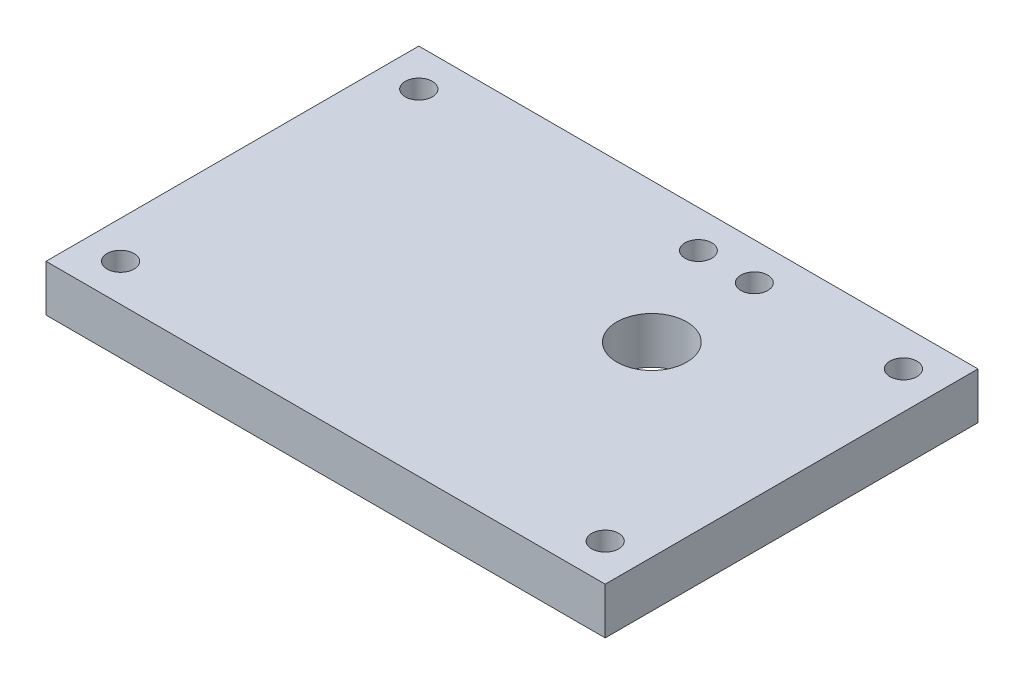
from build123d import *

# Parameters (mm, degrees)
SKETCH1_W           = 76.2
SKETCH1_H           = 50.8
BOSS_EXTRUDE1_DEPTH = 6.35
SKETCH2_R           = 1.8415
CUT_EXTRUDE1_DEPTH  = 47.228697797
SKETCH3_R           = 4.7625
SKETCH3_R_2         = 1.8288
CUT_EXTRUDE2_DEPTH  = 47.228697797


with BuildPart() as part:
    # Sketch1 → Boss-Extrude1 (new body)
    with BuildSketch(Plane(origin=(0, 0, 0), x_dir=(1, 0, 0), z_dir=(0, 1, 0))):
        Rectangle(SKETCH1_W, SKETCH1_H)
    extrude(amount=BOSS_EXTRUDE1_DEPTH)

    # Sketch2 → Cut-Extrude1 (cut, through all)
    with BuildSketch(Plane(origin=(0, 6.35, 0), x_dir=(1, 0, 0), z_dir=(0, 1, 0))):
        with Locations((-33.02, 20.32)):
            Circle(SKETCH2_R)
        with Locations((-33.02, -20.32)):
            Circle(SKETCH2_R)
        with Locations((33.02, -20.32)):
            Circle(SKETCH2_R)
        with Locations((33.02, 20.32)):
            Circle(SKETCH2_R)
    extrude(amount=-CUT_EXTRUDE1_DEPTH, mode=Mode.SUBTRACT)

    # Sketch3 → Cut-Extrude2 (cut, through all)
    with BuildSketch(Plane(origin=(0, 6.35, 0), x_dir=(1, 0, 0), z_dir=(0, 1, 0))):
        with Locations((12.7, 6.35)):
            Circle(SKETCH3_R)
        with Locations((5.08, 20.32)):
            Circle(SKETCH3_R_2)
        with Locations((12.7, 20.32)):
            Circle(SKETCH3_R_2)
    extrude(amount=-CUT_EXTRUDE2_DEPTH, mode=Mode.SUBTRACT)


solid = part.part
